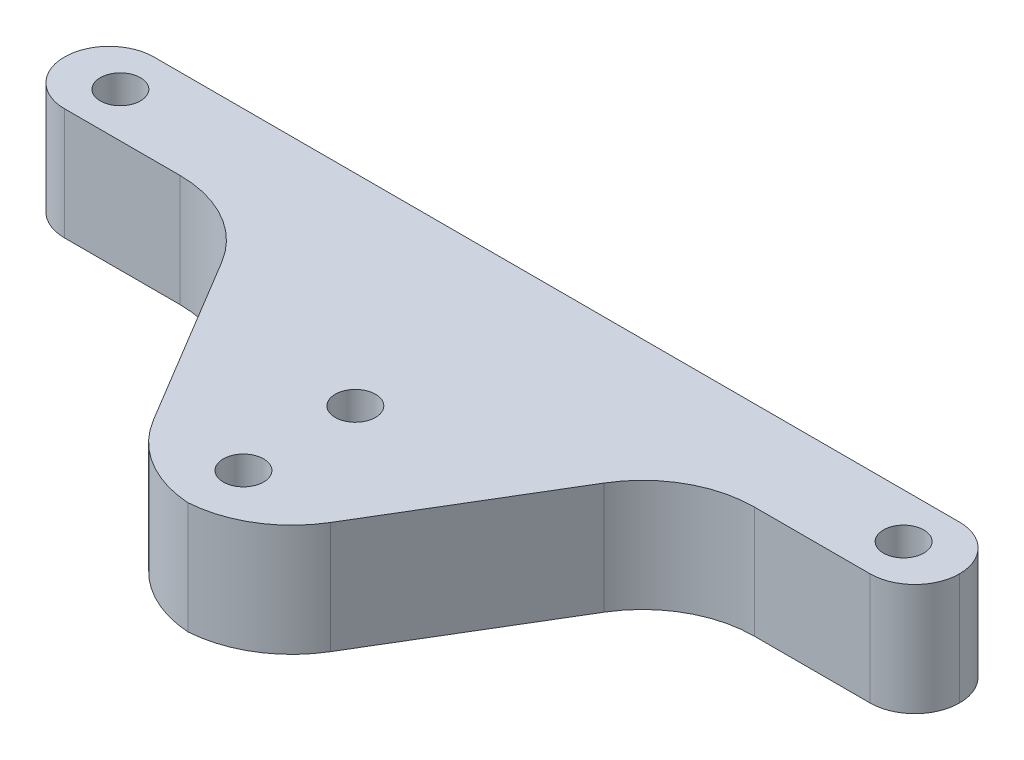
from build123d import *

# Parameters (mm, degrees)
SKETCH2_R           = 2.286
BOSS_EXTRUDE2_DEPTH = 12.7
FILLET1_R           = 5.08
FILLET2_R           = 12.7


# Some blends are built 0.0001 mm under size
with BuildPart() as part:
    # Sketch2 → Boss-Extrude2 (new body)
    with BuildSketch(Plane(origin=(0, 0, 0), x_dir=(1, 0, 0), z_dir=(0, 1, 0))):
        Polygon((-6.35, 0), (6.35, 0), (25.4, 31.75), (50.8, 31.75), (50.8, 41.91), (-50.8, 41.91), (-50.8, 31.75), (-25.4, 31.75), align=None)
        with Locations(Location((0, 19.05, 0), (0, 0, 270))):
            Circle(SKETCH2_R, mode=Mode.SUBTRACT)
        with Locations(Location((0, 6.35, 0), (0, 0, 270))):
            Circle(SKETCH2_R, mode=Mode.SUBTRACT)
        with Locations(Location((44.45, 36.83, 0), (0, 0, 270))):
            Circle(SKETCH2_R, mode=Mode.SUBTRACT)
        with Locations(Location((-44.45, 36.83, 0), (0, 0, 90))):
            Circle(SKETCH2_R, mode=Mode.SUBTRACT)
    extrude(amount=BOSS_EXTRUDE2_DEPTH)

    # Fillet1
    fillet1_edges = [part.edges().sort_by_distance(p)[0] for p in [
        (50.8, 6.35, -41.91),
        (50.8, 6.35, -31.75),
        (-50.8, 6.35, -41.91),
        (-50.8, 6.35, -31.75),
    ]]
    fillet(fillet1_edges, radius=FILLET1_R - 0.0001)  # a hair under: the kernel refuses the full size

    # Fillet2
    # the kernel refuses this fillet: 12.7 mm, written as the material it adds along each edge
    with BuildSketch(Plane(origin=(-25.4, 0, -31.75), x_dir=(0.5144957554275261, 0, 0.8574929257125444), z_dir=(0, 1, 0)), Plane(origin=(25.4, 0, -31.75), x_dir=(1, 0, 0), z_dir=(0, 1, 0))) as fillet2_piece_1:
        with BuildLine():
            CenterArc((FILLET2_R * 0.566190378969, -FILLET2_R), FILLET2_R, 90, 59.036243468)
            Line((-FILLET2_R * 0.291302546743, -FILLET2_R * 0.485504244572), (0, 0))
            Line((0, 0), (FILLET2_R * 0.566190378969, 0))
        make_face()
    extrude(amount=12.7)
    # the kernel refuses this fillet: 12.7 mm, written as the material it takes off along each edge
    with BuildSketch(Plane(origin=(-6.35, -17.976544532, 0), x_dir=(1, 0, 0), z_dir=(0, 1, 0)), Plane(origin=(6.35, -17.976544532, 0), x_dir=(0.514495755427526, 0, -0.8574929257125444), z_dir=(0, 1, 0))) as fillet2_2_piece_1:
        with BuildLine():
            CenterArc((FILLET2_R * 0.566190378969, FILLET2_R), FILLET2_R, 210.963756532, 59.036243468)
            Line((-FILLET2_R * 0.291302546743, FILLET2_R * 0.485504244572), (0, 0))
            Line((0, 0), (FILLET2_R * 0.566190378969, 0))
        make_face()
    extrude(amount=48.653089065, mode=Mode.SUBTRACT)


solid = part.part
